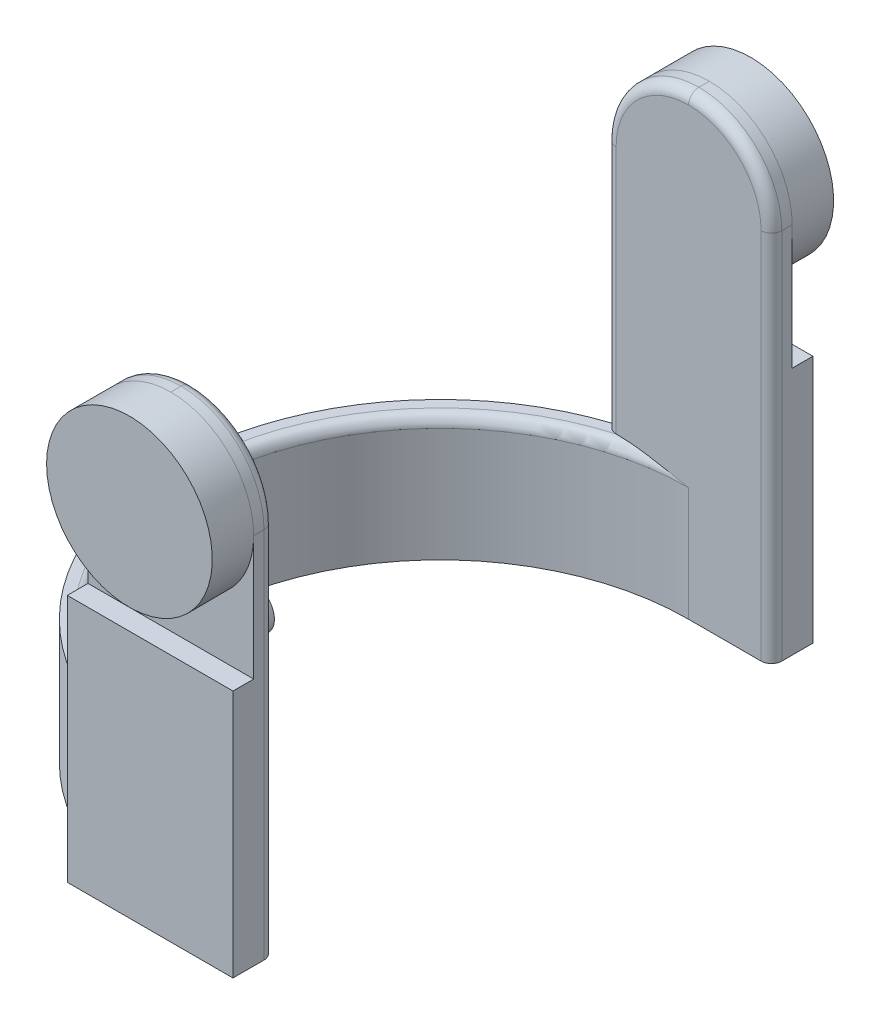
from build123d import *

# Parameters (mm, degrees)
BOSS_EXTRUDE1_DEPTH      = 30
SKETCH2_W                = 40
SKETCH2_H                = 10
BOSS_EXTRUDE2_DEPTH      = 110
SKETCH3_W                = 40
SKETCH3_H                = 5
CUT_EXTRUDE1_DEPTH       = 50
SKETCH4_R                = 20
BOSS_EXTRUDE4_DEPTH      = 10
FILLET1_R                = 20
FILLET1_OF_MIRROR1_R     = 20
BOSS_EXTRUDE5_DEPTH      = 10
BOSS_EXTRUDE5_DEPTH_BACK = 30
SKETCH5_W                = 10
SKETCH5_H                = 20
BOSS_EXTRUDE6_DEPTH      = 20
BOSS_EXTRUDE6_DEPTH_BACK = 20
SKETCH6_R                = 5
FILLET2_R                = 2.5


with BuildPart() as part:
    # Sketch1 → Boss-Extrude1 (new body)
    with BuildSketch(Plane(origin=(0, 0, 0), x_dir=(1, 0, 0), z_dir=(0, 1, 0))):
        with BuildLine():
            Line((0, 65), (0, 60))
            ThreePointArc((0, 60), (-60, 0), (0, -60))
            Line((0, -60), (0, -65))
            ThreePointArc((0, -65), (-65, 0), (0, 65))
        make_face()
    extrude(amount=BOSS_EXTRUDE1_DEPTH)

    # Sketch2 → Boss-Extrude2 (add)
    with BuildSketch(Plane(origin=(0, 0, 0), x_dir=(1, 0, 0), z_dir=(0, 1, 0))):
        with Locations((0, 65)):
            Rectangle(SKETCH2_W, SKETCH2_H)
    boss_extrude2 = extrude(amount=BOSS_EXTRUDE2_DEPTH)

    # Sketch3 → Cut-Extrude1 (cut)
    with BuildSketch(Plane(origin=(0, 110, 0), x_dir=(1, 0, 0), z_dir=(0, 1, 0))):
        with Locations((0, 67.5)):
            Rectangle(SKETCH3_W, SKETCH3_H)
    cut_extrude1 = extrude(amount=-CUT_EXTRUDE1_DEPTH, mode=Mode.SUBTRACT)

    # Sketch4 → Boss-Extrude4 (add)
    with BuildSketch(Plane(origin=(0, 0, -65), x_dir=(-1, 0, 0), z_dir=(0, 0, -1))):
        with Locations((0, 90)):
            Circle(SKETCH4_R)
    boss_extrude4 = extrude(amount=BOSS_EXTRUDE4_DEPTH)

    # Fillet1
    fillet1_edges = [part.edges().sort_by_distance(p)[0] for p in [
        (20, 110, -62.5),
        (-20, 110, -62.5),
    ]]
    fillet(fillet1_edges, radius=FILLET1_R - 0.0001)  # a hair under: the kernel refuses the full size

    # Mirror1: Boss-Extrude2, Cut-Extrude1, Boss-Extrude4 across plane
    add(boss_extrude2.mirror(Plane.XY))
    add(cut_extrude1.mirror(Plane.XY), mode=Mode.SUBTRACT)
    add(boss_extrude4.mirror(Plane.XY))

    # Fillet1 of Mirror1
    fillet1_of_mirror1_edges = [part.edges().sort_by_distance(p)[0] for p in [
        (20, 110, 62.5),
        (-20, 110, 62.5),
    ]]
    fillet(fillet1_of_mirror1_edges, radius=FILLET1_OF_MIRROR1_R - 0.0001)  # a hair under: the kernel refuses the full size

    # Sketch5 → Boss-Extrude5 (add, two sides: drawn at the far end of the back side and taken through both)
    with BuildSketch(Plane.XZ.offset(-BOSS_EXTRUDE5_DEPTH_BACK)):
        with Locations((-65, 0)):
            Rectangle(SKETCH5_W, SKETCH5_H)
    extrude(amount=BOSS_EXTRUDE5_DEPTH + BOSS_EXTRUDE5_DEPTH_BACK)

    # Sketch6 → Boss-Extrude6 (add, two sides: drawn at the far end of the back side and taken through both)
    with BuildSketch(Plane.XY.offset(-BOSS_EXTRUDE6_DEPTH_BACK)):
        with Locations((-65, -10)):
            Circle(SKETCH6_R)
    extrude(amount=BOSS_EXTRUDE6_DEPTH + BOSS_EXTRUDE6_DEPTH_BACK)

    # Fillet2
    fillet2_edges = [part.edges().sort_by_distance(p)[0] for p in [
        (-20, 60.00005, 60),
        (20, 45.00005, 60),
        (0, 110, 60),
        (14.142164913, 104.142164913, 60),
        (-14.142164913, 104.142164913, 60),
    ]]
    fillet(fillet2_edges, radius=FILLET2_R)
    fillet2_2_edges = [part.edges().sort_by_distance(p)[0] for p in [
        (-60, 30, 0),
    ]]
    fillet(fillet2_2_edges, radius=FILLET2_R - 0.0001)  # a hair under: the kernel refuses the full size
    fillet2_3_edges = [part.edges().sort_by_distance(p)[0] for p in [
        (-20, 60.00005, -60),
        (-14.142164913, 104.142164913, -60),
        (0, 110, -60),
        (14.142164913, 104.142164913, -60),
        (20, 45.00005, -60),
    ]]
    fillet(fillet2_3_edges, radius=FILLET2_R)


solid = part.part
